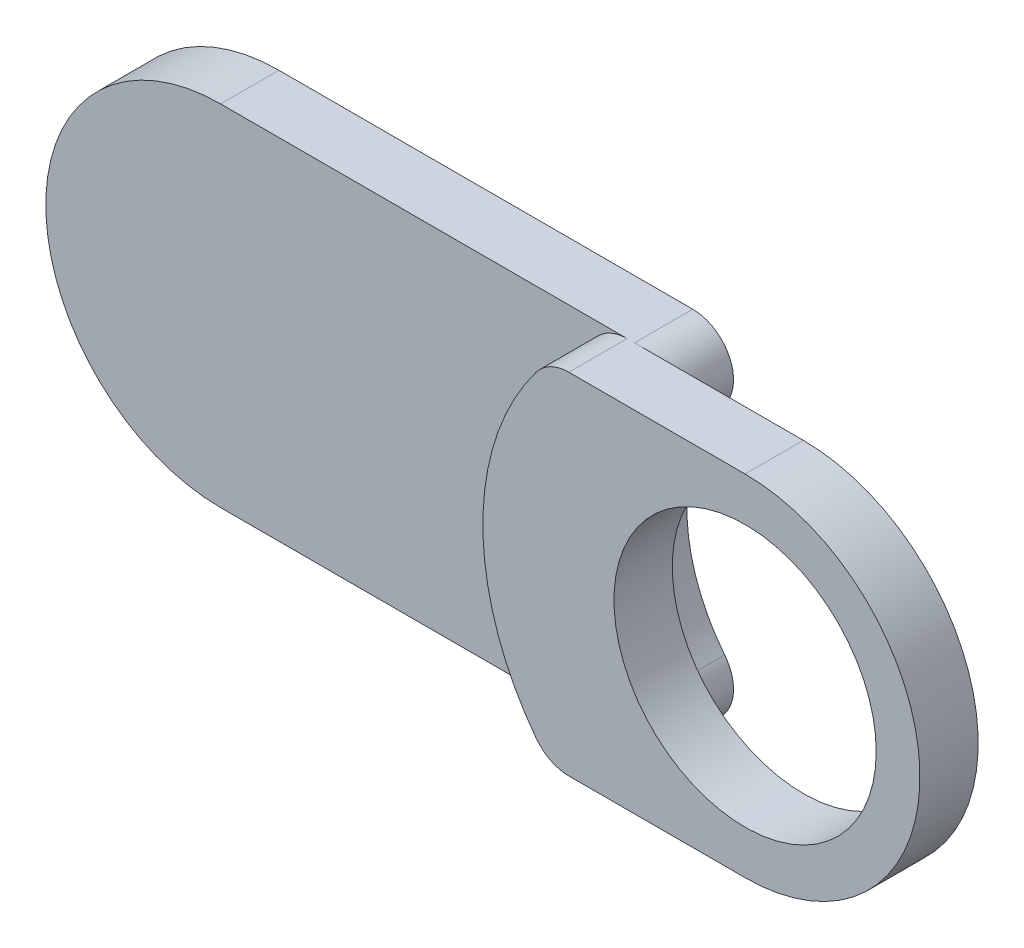
from build123d import *

# Parameters (mm, degrees)
SKETCH_1_R           = 3
SKETCH_1_R_2         = 2.25
EXTRUDE_1_DEPTH      = 1
EXTRUDE_2_DEPTH      = 1
EXTRUDE_2_DEPTH_BACK = 1
CUT_EXTRUDE_1_DEPTH  = 1
FILLET_START         = -2
FILLET_1_DEPTH       = 2
FILLET_2_R           = 0.7


with BuildPart() as part:
    # 草图1 → 凸台-拉伸1 (new body)
    with BuildSketch(Plane.XY):
        Circle(SKETCH_1_R)
        Circle(SKETCH_1_R_2, mode=Mode.SUBTRACT)
    extrude(amount=EXTRUDE_1_DEPTH)

    # 草图2 → 凸台-拉伸2 (add, two sides: drawn at the far end of the back side and taken through both)
    with BuildSketch(Plane(origin=(0, 0, 0), x_dir=(-1, 0, 0), z_dir=(0, 0, -1)).offset(-EXTRUDE_2_DEPTH_BACK)):
        with BuildLine():
            Line((0, -3), (10, -3))
            ThreePointArc((10, -3), (13, 0), (10, 3))
            Line((10, 3), (0, 3))
            ThreePointArc((0, 3), (3, 0), (0, -3))
        make_face()
    extrude(amount=EXTRUDE_2_DEPTH + EXTRUDE_2_DEPTH_BACK)

    # 草图3 → 切除-拉伸1 (cut)
    with BuildSketch(Plane(origin=(0, 0, 1), x_dir=(-1, 0, 0), z_dir=(0, 0, -1))):
        with BuildLine():
            Line((3.354101966, -3), (10, -3))
            ThreePointArc((10, -3), (13, 0), (10, 3))
            Line((10, 3), (3.354101966, 3))
            ThreePointArc((3.354101966, 3), (4.5, 0), (3.354101966, -3))
        make_face()
    extrude(amount=CUT_EXTRUDE_1_DEPTH, mode=Mode.SUBTRACT)

    # 圆角1: read off the stored shape, not the designer's step
    # 圆角1 outline → 圆角1 (cut)
    with BuildSketch(Plane.XY.offset(FILLET_START)):
        with BuildLine():
            ThreePointArc((0, -3), (-1.304876509, -2.701351013), (-2.349952986, -1.864864865))
            ThreePointArc((-2.349952986, -1.864864865), (-2.267960113, -2.604471185), (-2.898275349, -3))
            Line((-2.898275349, -3), (0, -3))
        make_face()
        with BuildLine():
            ThreePointArc((-2.898275349, 3), (-2.267960113, 2.604471185), (-2.349952986, 1.864864865))
            ThreePointArc((-2.349952986, 1.864864865), (-1.304876509, 2.701351013), (0, 3))
            Line((0, 3), (-2.898275349, 3))
        make_face()
    extrude(amount=FILLET_1_DEPTH, mode=Mode.SUBTRACT)

    # 圆角2
    fillet_2_edges = [part.edges().sort_by_distance(p)[0] for p in [
        (-3.354101966, 3, 0.5),
        (-3.354101966, -3, 0.5),
    ]]
    fillet(fillet_2_edges, radius=FILLET_2_R)


solid = part.part
